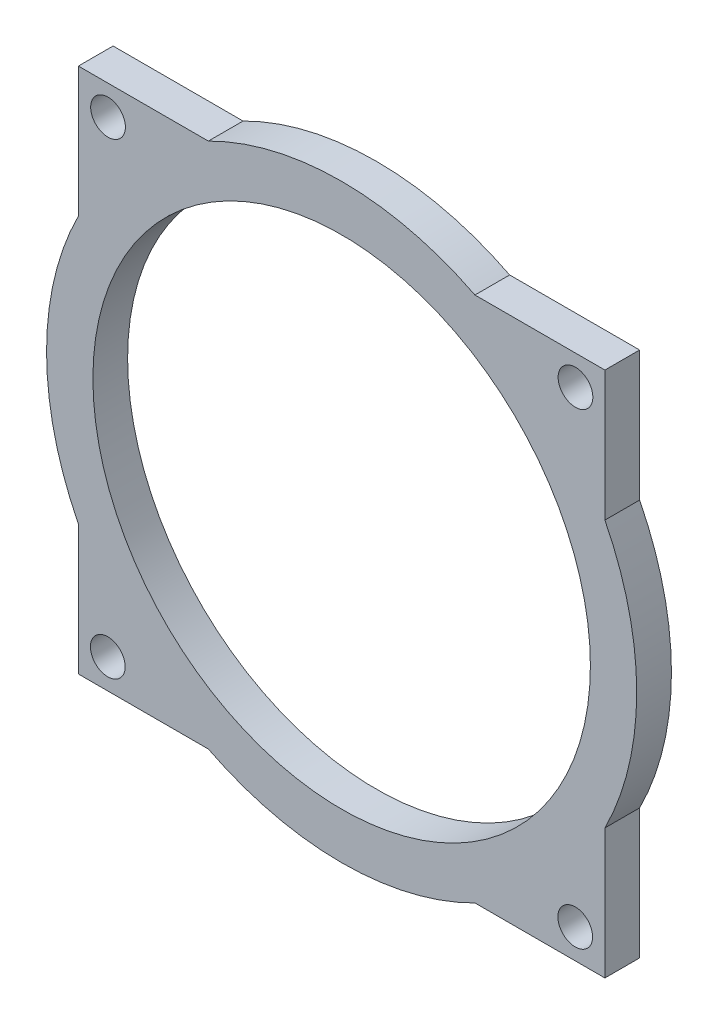
from build123d import *

# Parameters (mm, degrees)
SKETCH1_R           = 1.5
SKETCH1_R_2         = 21.49615086
BOSS_EXTRUDE1_DEPTH = 3


with BuildPart() as part:
    # Sketch1 → Boss-Extrude1 (new body)
    with BuildSketch(Plane.XY):
        with BuildLine():
            Line((11.519006034, -22.75), (22.75, -22.75))
            Line((22.75, -22.75), (22.75, -11.519006034))
            ThreePointArc((22.75, -11.519006034), (25.5, 0), (22.75, 11.519006034))
            Line((22.75, 11.519006034), (22.75, 22.75))
            Line((22.75, 22.75), (11.519006034, 22.75))
            ThreePointArc((11.519006034, 22.75), (0, 25.5), (-11.519006034, 22.75))
            Line((-11.519006034, 22.75), (-22.75, 22.75))
            Line((-22.75, 22.75), (-22.75, 11.519006034))
            ThreePointArc((-22.75, 11.519006034), (-25.5, 0), (-22.75, -11.519006034))
            Line((-22.75, -11.519006034), (-22.75, -22.75))
            Line((-22.75, -22.75), (-11.519006034, -22.75))
            ThreePointArc((-11.519006034, -22.75), (0, -25.5), (11.519006034, -22.75))
        make_face()
        with Locations((20.188817575, -20.207389371)):
            Circle(SKETCH1_R, mode=Mode.SUBTRACT)
        with Locations((-20.188817575, 20.207389371)):
            Circle(SKETCH1_R, mode=Mode.SUBTRACT)
        Circle(SKETCH1_R_2, mode=Mode.SUBTRACT)
        with Locations((20.207389371, 20.188817575)):
            Circle(SKETCH1_R, mode=Mode.SUBTRACT)
        with Locations((-20.207389371, -20.188817575)):
            Circle(SKETCH1_R, mode=Mode.SUBTRACT)
    extrude(amount=BOSS_EXTRUDE1_DEPTH)


solid = part.part
